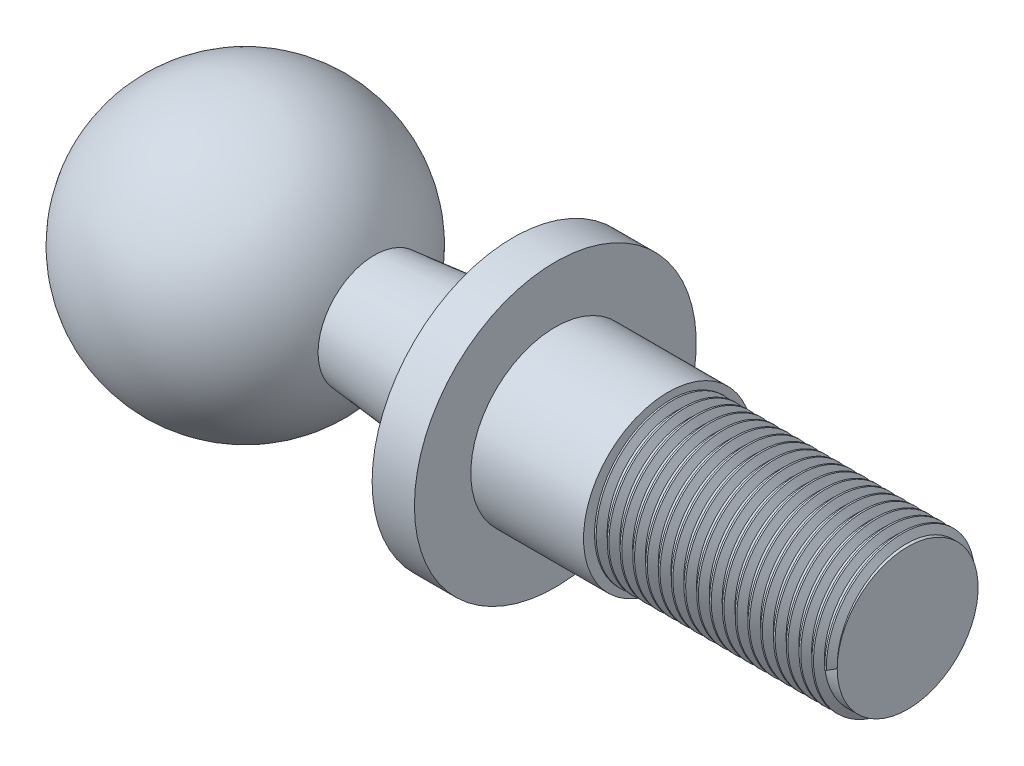
from build123d import *

# Parameters (mm, degrees)
SKETCH_1_R               = 3
EXTRUDE_1_DEPTH          = 4
SKETCH_2_R               = 5
EXTRUDE_2_DEPTH          = 1.5
CUT_EXTRUDE_1_DEPTH      = 18.492855685
CUT_EXTRUDE_1_DEPTH_BACK = 18.492855685
SKETCH_6_R               = 2.5
SKETCH_5_R               = 2
SKETCH_12_R              = 2.5
EXTRUDE_3_DEPTH          = 8.5
THREAD_1_PITCH           = 0.453571429


with BuildPart() as part:
    # 스케치1 → 보스-돌출1 (new body)
    with BuildSketch(Plane(origin=(0, 0, 0), x_dir=(0, 0, -1), z_dir=(1, 0, 0))):
        Circle(SKETCH_1_R)
    extrude(amount=EXTRUDE_1_DEPTH)

    # 스케치2 → 보스-돌출2 (add)
    with BuildSketch(Plane.ZY):
        Circle(SKETCH_2_R)
    extrude(amount=EXTRUDE_2_DEPTH)



with BuildPart() as body_2:
    # Sketch 3 → 회전1 (revolve)
    with BuildSketch(Plane.XY):
        with BuildLine():
            Line((-6, 0), (-16, 0))
            ThreePointArc((-16, 0), (-11, 5), (-6, 0))
        make_face()
    revolve(axis=Axis((-11, 0, 0), (-1, 0, 0)))

    # 스케치4 → 컷-돌출1 (cut, two sides: drawn at the far end of the back side and taken through both)
    with BuildSketch(Plane.XY.offset(-CUT_EXTRUDE_1_DEPTH_BACK)):
        Polygon((-15.582575695, 2), (-15.582575695, -2), (-16.349457215, -3.195380842), (-16.537644829, 3.666229092), align=None)
        Polygon((-5.650542785, -3.195380842), (-5.462355171, 3.666229092), (-6.417424305, 2), (-6.417424305, -2), align=None)
    extrude(amount=CUT_EXTRUDE_1_DEPTH + CUT_EXTRUDE_1_DEPTH_BACK, mode=Mode.SUBTRACT)


with BuildPart() as part_1:
    add(part.part)

    add(body_2.part)  # 로프트1 merges body 2
    # 스케치6 → 로프트1 section 0
    with BuildSketch(Plane.ZY.offset(1.5)):
        Circle(SKETCH_6_R)
    # 스케치5 → 로프트1 section 1
    with BuildSketch(Plane(origin=(-6.417424305, 0, 0), x_dir=(0, 0, -1), z_dir=(1, 0, 0))):
        Circle(SKETCH_5_R)
    loft()

    # 스케치12 → 보스-돌출3 (add)
    with BuildSketch(Plane(origin=(4, 0, 0), x_dir=(0, 0, -1), z_dir=(1, 0, 0))):
        Circle(SKETCH_12_R)
    extrude(amount=EXTRUDE_3_DEPTH)

    # 나사산1: the profile of Sketch 3 2 profile screwed along a right-hand helix of 18.740157 turns, 6 arcs to a turn; built about Z, then put on its axis
    thread_1_z = Axis((0, 0, 0), (0, 0, 1))
    thread_1_corners = [(2.4997, 0, -0.000173205), (2.745502736, 0, 0.141741071), (2.745502736, 0, 0.198437499), (2.4997, 0, 0.340351775)]
    with BuildLine(mode=Mode.PRIVATE) as thread_1_profile:
        Line(thread_1_corners[0], thread_1_corners[1])
        Line(thread_1_corners[1], thread_1_corners[2])
        Line(thread_1_corners[2], thread_1_corners[3])
        Line(thread_1_corners[3], thread_1_corners[0])
    thread_1_cap = Face(thread_1_profile.wire())
    thread_1_turn_angles = [0, 30, 60, 90, 120, 150, 180, 210, 240, 270, 300, 330, 360]
    thread_1_turn_weights = [1, 0.8660254037844387, 1, 0.8660254037844387, 1, 0.8660254037844387, 1, 0.8660254037844387, 1, 0.8660254037844387, 1, 0.8660254037844387, 1]
    thread_1_turn_rails = [Edge.make_bspline([Vector(p[0], p[1], 0).rotate(thread_1_z, thread_1_turn_angles[k]) / thread_1_turn_weights[k] + Vector(0, 0, p[2] + THREAD_1_PITCH * thread_1_turn_angles[k] / 360) for k in range(13)], [0, 0, 0, 1, 1, 2, 2, 3, 3, 4, 4, 5, 5, 6, 6, 6], 2, thread_1_turn_weights) for p in thread_1_corners]
    thread_1_turn_sides = [Face.make_surface_from_curves(thread_1_turn_rails[p[0]], thread_1_turn_rails[p[1]]) for p in [(0, 1), (1, 2), (2, 3), (3, 0)]]
    thread_1_last_angles = [6480, 6510, 6540, 6570, 6600, 6630, 6660, 6690, 6720, 6733.228346457, 6746.456692913]
    thread_1_last_weights = [1, 0.8660254037844387, 1, 0.8660254037844387, 1, 0.8660254037844387, 1, 0.8660254037844387, 1, 0.9734658096466748, 1]
    thread_1_last_rails = [Edge.make_bspline([Vector(p[0], p[1], 0).rotate(thread_1_z, thread_1_last_angles[k]) / thread_1_last_weights[k] + Vector(0, 0, p[2] + THREAD_1_PITCH * thread_1_last_angles[k] / 360) for k in range(11)], [0, 0, 0, 1, 1, 2, 2, 3, 3, 4, 4, 5, 5, 5], 2, thread_1_last_weights) for p in thread_1_corners]
    thread_1_last_sides = [Face.make_surface_from_curves(thread_1_last_rails[p[0]], thread_1_last_rails[p[1]]) for p in [(0, 1), (1, 2), (2, 3), (3, 0)]]
    thread_1 = Plane(origin=(12.5, 0, 0), x_dir=(0, 0, 1), z_dir=(-1, 0, 0)) * Solid(Shell([*[p.moved(Location((0, 0, THREAD_1_PITCH * i))) for i in range(18) for p in thread_1_turn_sides], *thread_1_last_sides, thread_1_cap, thread_1_cap.rotate(thread_1_z, 6746.456692913).moved(Location((0, 0, THREAD_1_PITCH * 6746.456692913 / 360)))]))
    add(thread_1)


solid = part_1.part
